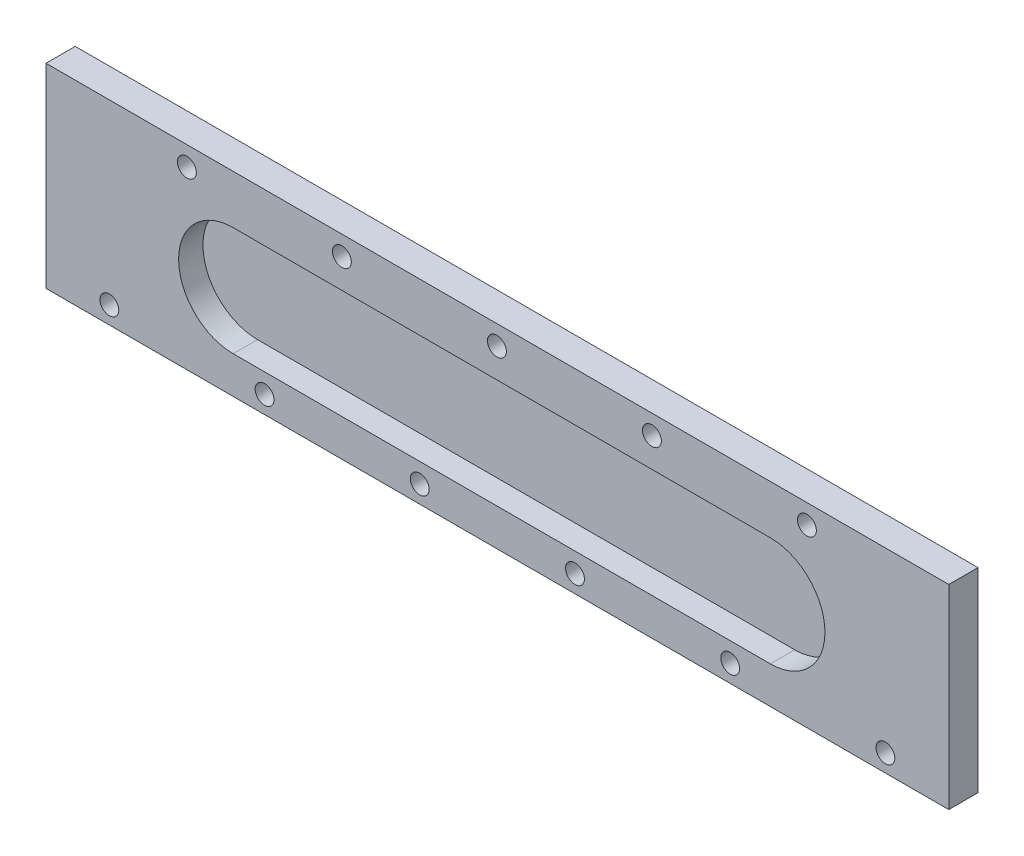
from build123d import *

# Parameters (mm, degrees)
SKETCH5_W                    = 235.204
SKETCH5_H                    = 50.8
BOSS_EXTRUDE3_DEPTH          = 7.62
CUT_EXTRUDE3_DEPTH           = 6.35
F_10_0_1935_DIAMETER_HOLE1_D = 4.9149


with BuildPart() as part:
    # Sketch5 → Boss-Extrude3 (new body)
    with BuildSketch(Plane.XY):
        with Locations((-117.602, 25.4)):
            Rectangle(SKETCH5_W, SKETCH5_H)
    extrude(amount=BOSS_EXTRUDE3_DEPTH)

    # Sketch6 → Cut-Extrude3 (cut)
    with BuildSketch(Plane.XY.offset(7.62)):
        with BuildLine():
            Line((-46.482, 9.652), (-186.436, 9.652))
            ThreePointArc((-186.436, 9.652), (-200.66, 23.876), (-186.436, 38.1))
            Line((-186.436, 38.1), (-46.482, 38.1))
            ThreePointArc((-46.482, 38.1), (-32.258, 23.876), (-46.482, 9.652))
        make_face()
    extrude(amount=-CUT_EXTRUDE3_DEPTH, mode=Mode.SUBTRACT)

    # #10 (0.1935) Diameter Hole1 (through all)
    with Locations(Plane(origin=(-198.501, 45.72, 7.62), x_dir=(1, 0, 0), z_dir=(0, 0, 1))):
        with Locations((0, 0), (40.386, 0), (80.772, 0), (121.158, 0), (161.544, 0), (-20.193, -41.171520692), (20.2438, -41.171520692), (60.6806, -41.171520692), (101.1174, -41.171520692), (141.5542, -41.171520692), (181.991, -41.171520692)):
            Hole(F_10_0_1935_DIAMETER_HOLE1_D / 2)


solid = part.part
